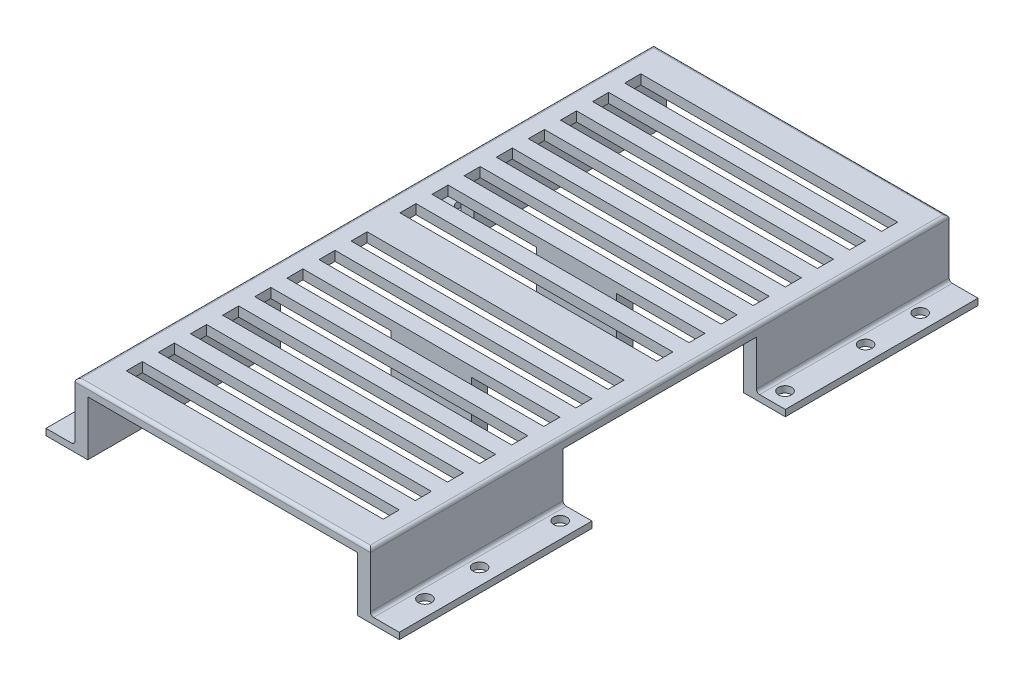
from build123d import *

# Parameters (mm, degrees)
SKETCH1_W               = 13
SKETCH1_H               = 60
SKETCH1_R               = 2.05
BOSS_EXTRUDE1_DEPTH     = 2
SKETCH2_W               = 4
SKETCH2_H               = 60
BOSS_EXTRUDE2_DEPTH     = 15
SKETCH3_W               = 46
SKETCH3_H               = 90.1
BOSS_EXTRUDE3_DEPTH     = 3
MIRROR1_START           = 17
MIRROR1_DEPTH           = 3
MIRROR1_2_OUTLINE_W     = 4
MIRROR1_2_OUTLINE_H     = 60
MIRROR1_2_DEPTH         = 17
MIRROR1_3_OUTLINE_W     = 9
MIRROR1_3_OUTLINE_H     = 60
MIRROR1_3_OUTLINE_R     = 2.05
MIRROR1_3_DEPTH         = 2
SKETCH4_W               = 80
SKETCH4_H               = 5
CUT_EXTRUDE1_DEPTH      = 3
LPATTERN1_COUNT         = 8
LPATTERN1_PITCH         = 10
MIRROR2_COPY_1_SKETCH_W = 80
MIRROR2_COPY_1_SKETCH_H = 5
MIRROR2_COPY_1_DEPTH    = 3
MIRROR2_COPY_2_SKETCH_W = 80
MIRROR2_COPY_2_SKETCH_H = 5
MIRROR2_COPY_2_DEPTH    = 3
MIRROR2_COPY_3_SKETCH_W = 80
MIRROR2_COPY_3_SKETCH_H = 5
MIRROR2_COPY_3_DEPTH    = 3
MIRROR2_COPY_4_SKETCH_W = 80
MIRROR2_COPY_4_SKETCH_H = 5
MIRROR2_COPY_4_DEPTH    = 3
MIRROR2_COPY_5_SKETCH_W = 80
MIRROR2_COPY_5_SKETCH_H = 5
MIRROR2_COPY_5_DEPTH    = 3
MIRROR2_COPY_6_SKETCH_W = 80
MIRROR2_COPY_6_SKETCH_H = 5
MIRROR2_COPY_6_DEPTH    = 3
MIRROR2_COPY_7_SKETCH_W = 80
MIRROR2_COPY_7_SKETCH_H = 5
MIRROR2_COPY_7_DEPTH    = 3
FILLET1_R               = 1
SKETCH5_W               = 25
SKETCH5_H               = 5
BOSS_EXTRUDE4_DEPTH     = 17


# Read off the part's stored shape, not the designer's step: Mirror1
with BuildPart() as part:
    # Sketch1 → Boss-Extrude1 (new body)
    with BuildSketch(Plane(origin=(0, 0, 0), x_dir=(1, 0, 0), z_dir=(0, 1, 0))):
        with Locations((48.5, 60.1)):
            Rectangle(SKETCH1_W, SKETCH1_H)
        with Locations(Location((50, 77.1, 0), (0, 0, 270))):
            Circle(SKETCH1_R, mode=Mode.SUBTRACT)
        with Locations(Location((50, 60.1, 0), (0, 0, 270))):
            Circle(SKETCH1_R, mode=Mode.SUBTRACT)
        with Locations(Location((50, 35, 0), (0, 0, 270))):
            Circle(SKETCH1_R, mode=Mode.SUBTRACT)
    extrude(amount=BOSS_EXTRUDE1_DEPTH)

    # Sketch2 → Boss-Extrude2 (add)
    with BuildSketch(Plane(origin=(0, 2, 0), x_dir=(1, 0, 0), z_dir=(0, 1, 0))):
        with Locations((44, 60.1)):
            Rectangle(SKETCH2_W, SKETCH2_H)
    extrude(amount=BOSS_EXTRUDE2_DEPTH)

    # Sketch3 → Boss-Extrude3 (add)
    with BuildSketch(Plane(origin=(0, 17, 0), x_dir=(1, 0, 0), z_dir=(0, 1, 0))):
        with Locations((23, 45.05)):
            Rectangle(SKETCH3_W, SKETCH3_H)
    extrude(amount=BOSS_EXTRUDE3_DEPTH)

    # Mirror1 outline → Mirror1 (add)
    with BuildSketch(Plane(origin=(0, 0, 0), x_dir=(1, 0, 0), z_dir=(0, 1, 0)).offset(MIRROR1_START)):
        Polygon((46, -90.1), (46, 0), (0, 0), (0, 90.1), (-46, 90.1), (-46, -90.1), align=None)
    extrude(amount=MIRROR1_DEPTH)

    # Mirror1 2 outline → Mirror1 2 (add)
    with BuildSketch(Plane(origin=(0, 0, 0), x_dir=(1, 0, 0), z_dir=(0, 1, 0))):
        with Locations((44, -60.1)):
            Rectangle(MIRROR1_2_OUTLINE_W, MIRROR1_2_OUTLINE_H)
        with Locations((-44, -60.1)):
            Rectangle(MIRROR1_2_OUTLINE_W, MIRROR1_2_OUTLINE_H)
        with Locations((-44, 60.1)):
            Rectangle(MIRROR1_2_OUTLINE_W, MIRROR1_2_OUTLINE_H)
    extrude(amount=MIRROR1_2_DEPTH)

    # Mirror1 3 outline → Mirror1 3 (add)
    # profile 1 of 3: a face of its own
    with BuildSketch(Plane(origin=(0, 0, 0), x_dir=(1, 0, 0), z_dir=(0, 1, 0))):
        with Locations((50.5, -60.1)):
            Rectangle(MIRROR1_3_OUTLINE_W, MIRROR1_3_OUTLINE_H)
        with Locations((50, -77.1)):
            Circle(MIRROR1_3_OUTLINE_R, mode=Mode.SUBTRACT)
        with Locations((50, -60.1)):
            Circle(MIRROR1_3_OUTLINE_R, mode=Mode.SUBTRACT)
        with Locations((50, -35)):
            Circle(MIRROR1_3_OUTLINE_R, mode=Mode.SUBTRACT)
    # profile 2 of 3: a face of its own
    with BuildSketch(Plane(origin=(0, 0, 0), x_dir=(1, 0, 0), z_dir=(0, 1, 0))):
        with Locations((-50.5, -60.1)):
            Rectangle(MIRROR1_3_OUTLINE_W, MIRROR1_3_OUTLINE_H)
        with Locations((-50, -77.1)):
            Circle(MIRROR1_3_OUTLINE_R, mode=Mode.SUBTRACT)
        with Locations((-50, -60.1)):
            Circle(MIRROR1_3_OUTLINE_R, mode=Mode.SUBTRACT)
        with Locations((-50, -35)):
            Circle(MIRROR1_3_OUTLINE_R, mode=Mode.SUBTRACT)
    # profile 3 of 3: a face of its own
    with BuildSketch(Plane(origin=(0, 0, 0), x_dir=(1, 0, 0), z_dir=(0, 1, 0))):
        with Locations((-50.5, 60.1)):
            Rectangle(MIRROR1_3_OUTLINE_W, MIRROR1_3_OUTLINE_H)
        with Locations((-50, 35)):
            Circle(MIRROR1_3_OUTLINE_R, mode=Mode.SUBTRACT)
        with Locations((-50, 60.1)):
            Circle(MIRROR1_3_OUTLINE_R, mode=Mode.SUBTRACT)
        with Locations((-50, 77.1)):
            Circle(MIRROR1_3_OUTLINE_R, mode=Mode.SUBTRACT)
    extrude(amount=MIRROR1_3_DEPTH)

    # Sketch4 → Cut-Extrude1 (cut)
    with BuildSketch(Plane(origin=(0, 20, 0), x_dir=(1, 0, 0), z_dir=(0, 1, 0))):
        with Locations((0, 77.6)):
            Rectangle(SKETCH4_W, SKETCH4_H)
    cut_extrude1 = extrude(amount=-CUT_EXTRUDE1_DEPTH, mode=Mode.SUBTRACT)

    # LPattern1: Cut-Extrude1 ×8
    with Locations(*[(0, 0, i * LPATTERN1_PITCH) for i in range(1, LPATTERN1_COUNT)]):
        add(cut_extrude1, mode=Mode.SUBTRACT)

    # Mirror2: Cut-Extrude1 across Front Plane
    add(cut_extrude1.mirror(Plane.XY), mode=Mode.SUBTRACT)

    # Mirror2 copy 1 sketch → Mirror2 copy 1 (cut)
    with BuildSketch(Plane(origin=(0, 20, -10), x_dir=(1, 0, 0), z_dir=(0, 1, 0))):
        with Locations((0, -77.6)):
            Rectangle(MIRROR2_COPY_1_SKETCH_W, MIRROR2_COPY_1_SKETCH_H)
    extrude(amount=-MIRROR2_COPY_1_DEPTH, mode=Mode.SUBTRACT)

    # Mirror2 copy 2 sketch → Mirror2 copy 2 (cut)
    with BuildSketch(Plane(origin=(0, 20, -20), x_dir=(1, 0, 0), z_dir=(0, 1, 0))):
        with Locations((0, -77.6)):
            Rectangle(MIRROR2_COPY_2_SKETCH_W, MIRROR2_COPY_2_SKETCH_H)
    extrude(amount=-MIRROR2_COPY_2_DEPTH, mode=Mode.SUBTRACT)

    # Mirror2 copy 3 sketch → Mirror2 copy 3 (cut)
    with BuildSketch(Plane(origin=(0, 20, -30), x_dir=(1, 0, 0), z_dir=(0, 1, 0))):
        with Locations((0, -77.6)):
            Rectangle(MIRROR2_COPY_3_SKETCH_W, MIRROR2_COPY_3_SKETCH_H)
    extrude(amount=-MIRROR2_COPY_3_DEPTH, mode=Mode.SUBTRACT)

    # Mirror2 copy 4 sketch → Mirror2 copy 4 (cut)
    with BuildSketch(Plane(origin=(0, 20, -40), x_dir=(1, 0, 0), z_dir=(0, 1, 0))):
        with Locations((0, -77.6)):
            Rectangle(MIRROR2_COPY_4_SKETCH_W, MIRROR2_COPY_4_SKETCH_H)
    extrude(amount=-MIRROR2_COPY_4_DEPTH, mode=Mode.SUBTRACT)

    # Mirror2 copy 5 sketch → Mirror2 copy 5 (cut)
    with BuildSketch(Plane(origin=(0, 20, -50), x_dir=(1, 0, 0), z_dir=(0, 1, 0))):
        with Locations((0, -77.6)):
            Rectangle(MIRROR2_COPY_5_SKETCH_W, MIRROR2_COPY_5_SKETCH_H)
    extrude(amount=-MIRROR2_COPY_5_DEPTH, mode=Mode.SUBTRACT)

    # Mirror2 copy 6 sketch → Mirror2 copy 6 (cut)
    with BuildSketch(Plane(origin=(0, 20, -60), x_dir=(1, 0, 0), z_dir=(0, 1, 0))):
        with Locations((0, -77.6)):
            Rectangle(MIRROR2_COPY_6_SKETCH_W, MIRROR2_COPY_6_SKETCH_H)
    extrude(amount=-MIRROR2_COPY_6_DEPTH, mode=Mode.SUBTRACT)

    # Mirror2 copy 7 sketch → Mirror2 copy 7 (cut)
    with BuildSketch(Plane(origin=(0, 20, -70), x_dir=(1, 0, 0), z_dir=(0, 1, 0))):
        with Locations((0, -77.6)):
            Rectangle(MIRROR2_COPY_7_SKETCH_W, MIRROR2_COPY_7_SKETCH_H)
    extrude(amount=-MIRROR2_COPY_7_DEPTH, mode=Mode.SUBTRACT)

    # Fillet1
    fillet1_edges = [part.edges().sort_by_distance(p)[0] for p in [
        (46, 2, -60.1),
        (46, 20, 0),
        (0, 20, -90.1),
        (-46, 2, -60.1),
        (-46, 2, 60.1),
        (-46, 20, 0),
        (46, 2, 60.1),
        (0, 20, 90.1),
    ]]
    fillet(fillet1_edges, radius=FILLET1_R)

    # Sketch5 → Boss-Extrude4 (add)
    with BuildSketch(Plane.XZ.offset(-17)):
        with Locations((0, 22.6)):
            Rectangle(SKETCH5_W, SKETCH5_H)
        with Locations((0, -22.6)):
            Rectangle(SKETCH5_W, SKETCH5_H)
    extrude(amount=BOSS_EXTRUDE4_DEPTH)


solid = part.part
